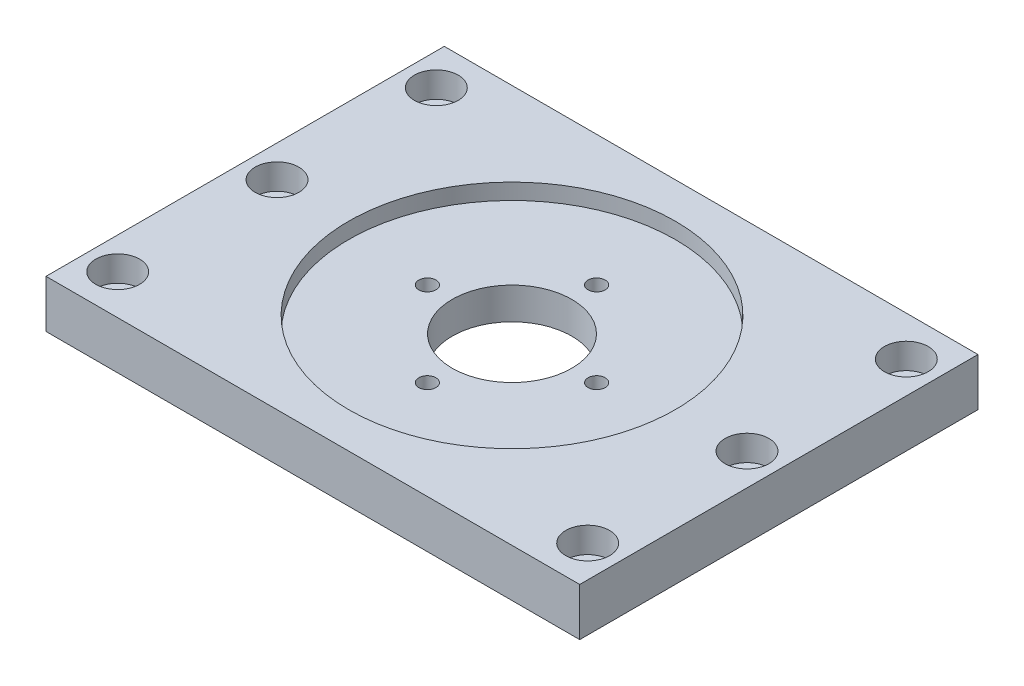
from build123d import *

# Parameters (mm, degrees)
SKETCH1_W                                           = 134
SKETCH1_H                                           = 100
BOSS_EXTRUDE1_DEPTH                                 = 12
SKETCH2_R                                           = 41
CUT_EXTRUDE1_DEPTH                                  = 4
SKETCH3_R                                           = 15
CUT_EXTRUDE2_DEPTH                                  = 84.982140959
M4_CLEARANCE_HOLE1_D                                = 4.3
M4_CLEARANCE_HOLE1_DEPTH                            = 15
M4_CLEARANCE_HOLE1_TIP                              = 1.291850331
CBORE_FOR_M6_HEX_SOCKET_HEAD_CAP_SCREW1_D           = 6.6
CBORE_FOR_M6_HEX_SOCKET_HEAD_CAP_SCREW1_DEPTH       = 15
CBORE_FOR_M6_HEX_SOCKET_HEAD_CAP_SCREW1_CBORE_D     = 11
CBORE_FOR_M6_HEX_SOCKET_HEAD_CAP_SCREW1_CBORE_DEPTH = 6.4
CBORE_FOR_M6_HEX_SOCKET_HEAD_CAP_SCREW1_TIP         = 1.982840043


with BuildPart() as part:
    # Sketch1 → Boss-Extrude1 (new body)
    with BuildSketch(Plane(origin=(0, 0, 0), x_dir=(1, 0, 0), z_dir=(0, 1, 0))):
        Rectangle(SKETCH1_W, SKETCH1_H)
    extrude(amount=BOSS_EXTRUDE1_DEPTH)

    # Sketch2 → Cut-Extrude1 (cut)
    with BuildSketch(Plane(origin=(0, 12, 0), x_dir=(1, 0, 0), z_dir=(0, 1, 0))):
        Circle(SKETCH2_R)
    extrude(amount=-CUT_EXTRUDE1_DEPTH, mode=Mode.SUBTRACT)

    # Sketch3 → Cut-Extrude2 (cut, through all)
    with BuildSketch(Plane(origin=(0, 8, 0), x_dir=(1, 0, 0), z_dir=(0, 1, 0))):
        Circle(SKETCH3_R)
    extrude(amount=-CUT_EXTRUDE2_DEPTH, mode=Mode.SUBTRACT)

    # M4 Clearance Hole1
    with Locations(Plane(origin=(0, 0, 0), x_dir=(-1, 0, 0), z_dir=(0, -1, 0))):
        with Locations((-21.25, 0), (0, 21.25), (21.25, 0), (0, -21.25)):
            Hole(M4_CLEARANCE_HOLE1_D / 2, depth=M4_CLEARANCE_HOLE1_DEPTH)
            with Locations((0, 0, -(M4_CLEARANCE_HOLE1_DEPTH + M4_CLEARANCE_HOLE1_TIP / 2))):  # 118° drill point
                Cone(0, M4_CLEARANCE_HOLE1_D / 2, M4_CLEARANCE_HOLE1_TIP, mode=Mode.SUBTRACT)

    # CBORE for M6 Hex Socket Head Cap Screw1
    with Locations(Plane(origin=(0, 12, 0), x_dir=(1, 0, 0), z_dir=(0, 1, 0))):
        with Locations((59, 40), (-59, 40), (-59, 0), (-59, -40), (59, 0), (59, -40)):
            CounterBoreHole(CBORE_FOR_M6_HEX_SOCKET_HEAD_CAP_SCREW1_D / 2, CBORE_FOR_M6_HEX_SOCKET_HEAD_CAP_SCREW1_CBORE_D / 2, CBORE_FOR_M6_HEX_SOCKET_HEAD_CAP_SCREW1_CBORE_DEPTH, depth=CBORE_FOR_M6_HEX_SOCKET_HEAD_CAP_SCREW1_DEPTH)
            with Locations((0, 0, -(CBORE_FOR_M6_HEX_SOCKET_HEAD_CAP_SCREW1_DEPTH + CBORE_FOR_M6_HEX_SOCKET_HEAD_CAP_SCREW1_TIP / 2))):  # 118° drill point
                Cone(0, CBORE_FOR_M6_HEX_SOCKET_HEAD_CAP_SCREW1_D / 2, CBORE_FOR_M6_HEX_SOCKET_HEAD_CAP_SCREW1_TIP, mode=Mode.SUBTRACT)


solid = part.part
